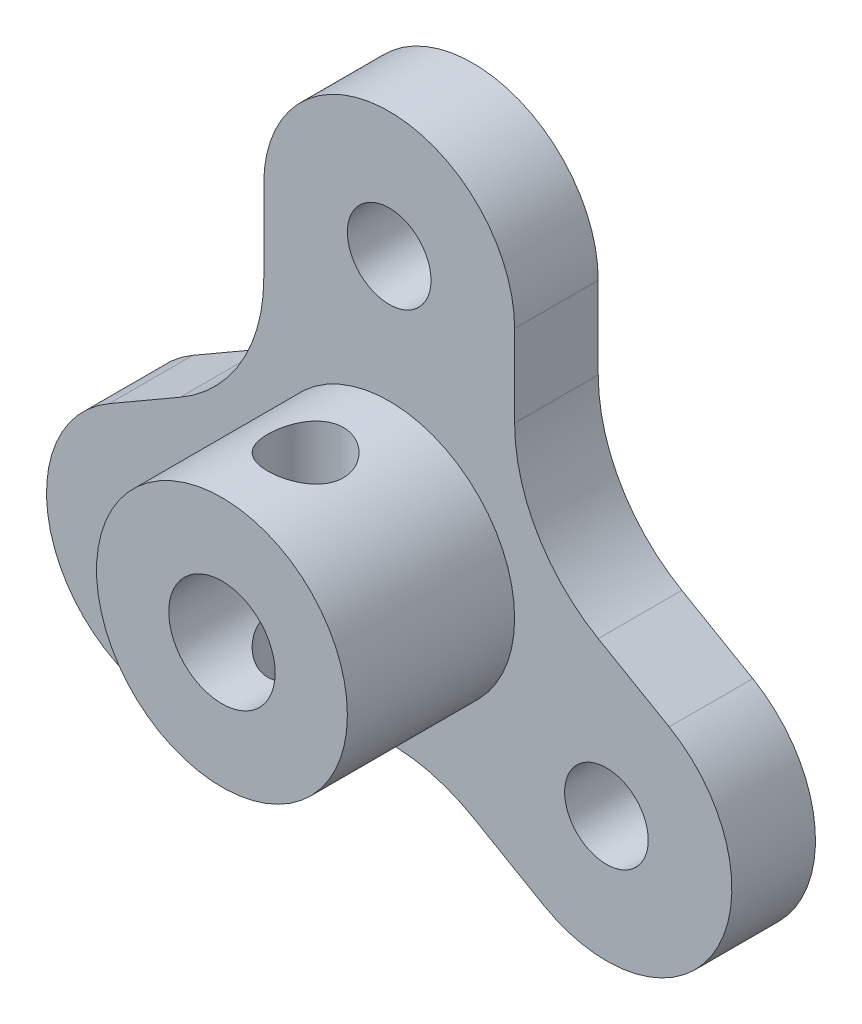
from build123d import *

# Parameters (mm, degrees)
F_1_8_0_1250_DOWEL_HOLE1_D = 3.175
SKETCH6_W                  = 1.4351
SKETCH6_H                  = 15.875
CIRPATTERN1_COUNT          = 2
CIRPATTERN2_COUNT          = 3
CUT_EXTRUDE1_START         = -10
SKETCH7_R                  = 15.875
CUT_EXTRUDE1_DEPTH         = 10
FILLET1_R                  = 6.35


with BuildPart() as part:
    # Sketch1 → Revolve1 (revolve)
    with BuildSketch(Plane(origin=(0, 0, 0), x_dir=(0, 0, -1), z_dir=(1, 0, 0))):
        Polygon((0, 2.0193), (0, 4.7625), (6.35, 4.7625), (6.35, 15.875), (9.525, 15.875), (9.525, 2.0193), align=None)
    revolve(axis=Axis((0, 0, 0), (0, 0, -1)))

    # 1/8 (0.1250) Dowel Hole1 (through all)
    with Locations(Plane.XY.offset(-6.35)):
        with Locations((0, 9.525), (0, 0)):
            f_1_8_0_1250_dowel_hole1 = Hole(F_1_8_0_1250_DOWEL_HOLE1_D / 2)

    # Sketch6 → #6-40 Tapped Hole1 (revolve, cut)
    with BuildSketch(Plane(origin=(0, 0, -3.175), x_dir=(0, 0, -1), z_dir=(1, 0, 0))):
        with Locations((0.71755, 7.9375)):
            Rectangle(SKETCH6_W, SKETCH6_H)
    f_6_40_tapped_hole1 = revolve(axis=Axis((0, -6.35, -3.175), (0, 1, 0)), mode=Mode.SUBTRACT)

    # CirPattern1: #6-40 Tapped Hole1 ×2 about axis
    cirpattern1_axis = Axis((0, 0, 0), (0, 0, 1))
    for i in range(1, CIRPATTERN1_COUNT):
        add(f_6_40_tapped_hole1.rotate(cirpattern1_axis, i * 360 / CIRPATTERN1_COUNT), mode=Mode.SUBTRACT)

    # CirPattern2: 1/8 (0.1250) Dowel Hole1 ×3 about axis
    cirpattern2_axis = Axis((0, 0, 0), (0, 0, 1))
    for i in range(1, CIRPATTERN2_COUNT):
        add(f_1_8_0_1250_dowel_hole1.rotate(cirpattern2_axis, i * 360 / CIRPATTERN2_COUNT), mode=Mode.SUBTRACT)

    # Sketch7 → Cut-Extrude1 (cut)
    with BuildSketch(Plane.XY.offset(-6.35).offset(CUT_EXTRUDE1_START)):
        Circle(SKETCH7_R)
        with BuildLine():
            ThreePointArc((-4.7625, 9.525), (0, 14.2875), (4.7625, 9.525))
            Line((4.7625, 9.525), (4.7625, 2.749630657))
            Line((4.7625, 2.749630657), (10.630141971, -0.638054014))
            ThreePointArc((10.630141971, -0.638054014), (12.373337957, -7.14375), (5.867641971, -8.886945986))
            Line((5.867641971, -8.886945986), (0, -5.499261314))
            Line((0, -5.499261314), (-5.867641971, -8.886945986))
            ThreePointArc((-5.867641971, -8.886945986), (-12.373337957, -7.14375), (-10.630141971, -0.638054014))
            Line((-10.630141971, -0.638054014), (-4.7625, 2.749630657))
            Line((-4.7625, 2.749630657), (-4.7625, 9.525))
        make_face(mode=Mode.SUBTRACT)
    extrude(amount=CUT_EXTRUDE1_DEPTH, mode=Mode.SUBTRACT)

    # Fillet1
    fillet1_edges = [part.edges().sort_by_distance(p)[0] for p in [
        (-4.7625, 2.749630657, -7.9375),
        (0, -5.499261314, -7.9375),
        (4.7625, 2.749630657, -7.9375),
    ]]
    fillet(fillet1_edges, radius=FILLET1_R)


solid = part.part
